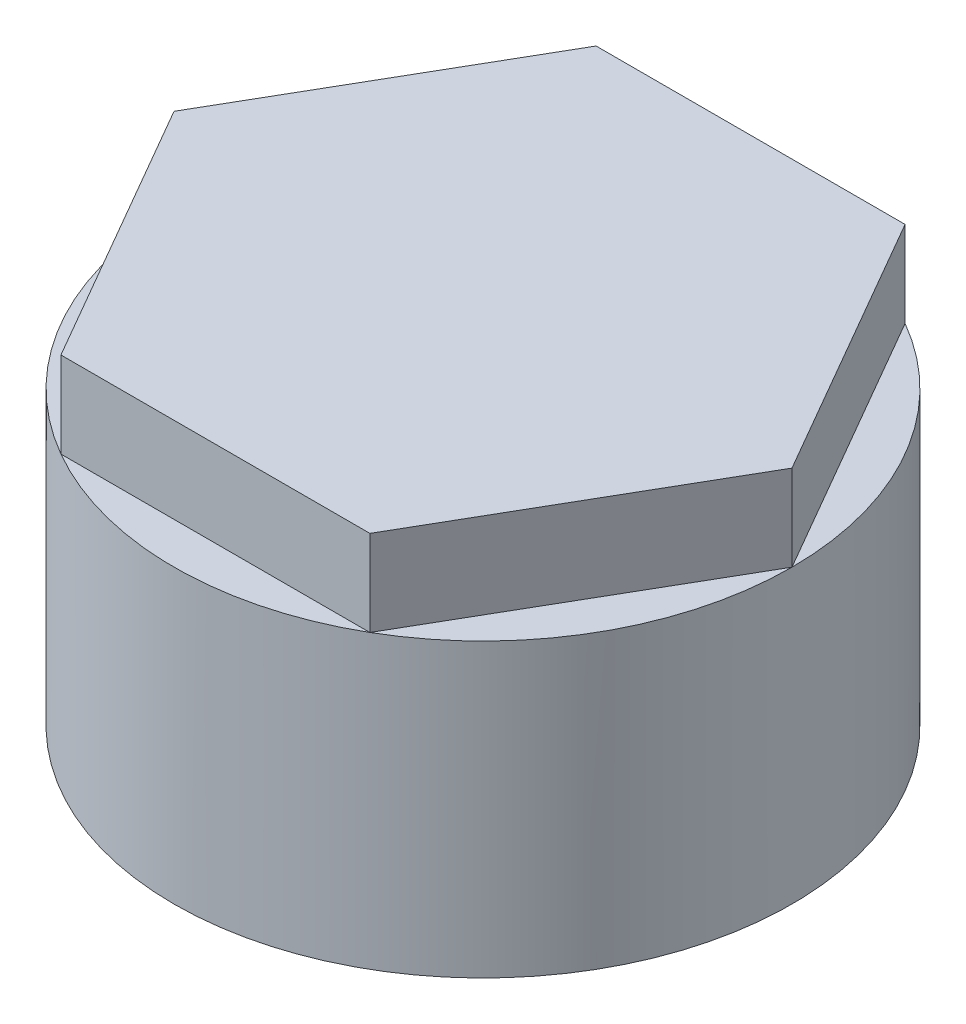
from build123d import *

# Parameters (mm, degrees)
TAGLIO_ESTRUSIONE1_START = -5
TAGLIO_ESTRUSIONE1_DEPTH = 5


with BuildPart() as part:
    # Schizzo1 → Rivoluzione1 (revolve)
    with BuildSketch(Plane.XY):
        Polygon((-15, 0), (-15, 16), (0, 16), (0, 22), (-18, 22), (-18, 0), align=None)
    revolve(axis=Axis((0, 0, 0), (0, 1, 0)))

    # Schizzo2 → Taglio-Estrusione1 (cut)
    with BuildSketch(Plane(origin=(0, 22, 0), x_dir=(1, 0, 0), z_dir=(0, 1, 0)).offset(TAGLIO_ESTRUSIONE1_START)):
        with BuildLine():
            ThreePointArc((9, 15.588457268), (0, 18), (-9, 15.588457268))
            Line((-9, 15.588457268), (9, 15.588457268))
        make_face()
        with BuildLine():
            Line((-18, 0), (-9, 15.588457268))
            ThreePointArc((-9, 15.588457268), (-15.588457268, 9), (-18, 0))
        make_face()
        with BuildLine():
            ThreePointArc((18, 0), (15.588457268, 9), (9, 15.588457268))
            Line((9, 15.588457268), (18, 0))
        make_face()
        with BuildLine():
            Line((-9, -15.588457268), (-18, 0))
            ThreePointArc((-18, 0), (-15.588457268, -9), (-9, -15.588457268))
        make_face()
        with BuildLine():
            ThreePointArc((9, -15.588457268), (15.588457268, -9), (18, 0))
            Line((18, 0), (9, -15.588457268))
        make_face()
        with BuildLine():
            Line((9, -15.588457268), (-9, -15.588457268))
            ThreePointArc((-9, -15.588457268), (0, -18), (9, -15.588457268))
        make_face()
    extrude(amount=TAGLIO_ESTRUSIONE1_DEPTH, mode=Mode.SUBTRACT)


solid = part.part
